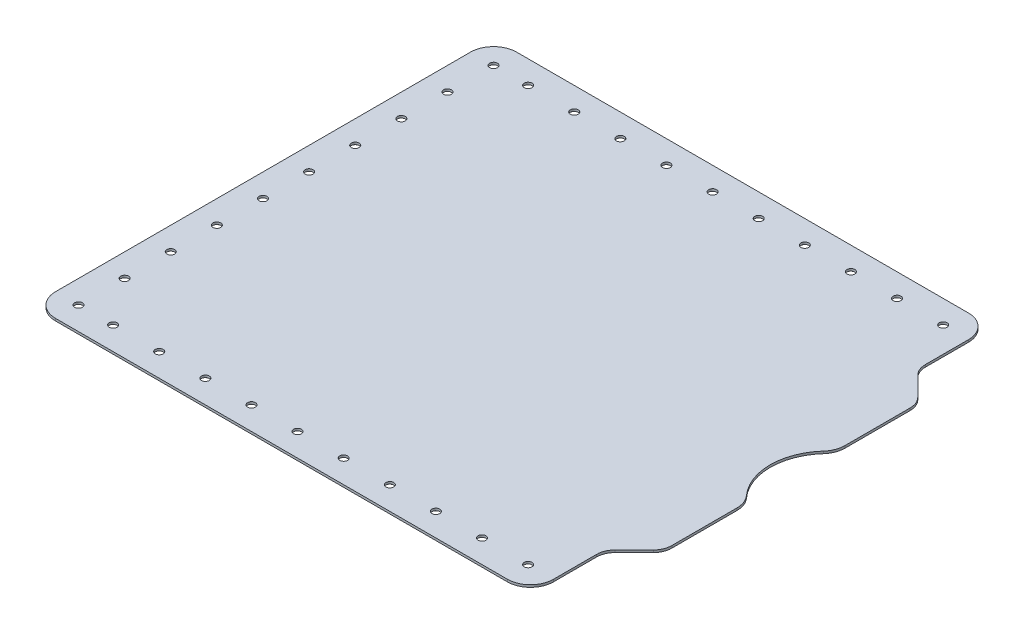
from build123d import *

# Parameters (mm, degrees)
SKETCH1_W                      = 229
SKETCH1_H                      = 200
BOSS_EXTRUDE1_DEPTH            = 1
CUT_EXTRUDE1_DEPTH             = 153.023846814
FILLET1_R                      = 8
FILLET2_R                      = 10
M3_CLEARANCE_HOLE1_AT_2_COUNT  = 2
M3_CLEARANCE_HOLE1_AT_2_PITCH  = 20
M3_CLEARANCE_HOLE1_AT_3_COUNT  = 2
M3_CLEARANCE_HOLE1_AT_3_PITCH  = 40
M3_CLEARANCE_HOLE1_AT_4_COUNT  = 2
M3_CLEARANCE_HOLE1_AT_4_PITCH  = 60
M3_CLEARANCE_HOLE1_AT_5_COUNT  = 2
M3_CLEARANCE_HOLE1_AT_5_PITCH  = 80
M3_CLEARANCE_HOLE1_AT_6_COUNT  = 2
M3_CLEARANCE_HOLE1_AT_6_PITCH  = 100
M3_CLEARANCE_HOLE1_AT_7_COUNT  = 2
M3_CLEARANCE_HOLE1_AT_7_PITCH  = 120
M3_CLEARANCE_HOLE1_AT_8_COUNT  = 2
M3_CLEARANCE_HOLE1_AT_8_PITCH  = 140
M3_CLEARANCE_HOLE1_AT_9_COUNT  = 2
M3_CLEARANCE_HOLE1_AT_9_PITCH  = 160
M3_CLEARANCE_HOLE1_AT_10_COUNT = 2
M3_CLEARANCE_HOLE1_AT_10_PITCH = 180
M3_CLEARANCE_HOLE2_AT_2_COUNT  = 2
M3_CLEARANCE_HOLE2_AT_2_PITCH  = 20
M3_CLEARANCE_HOLE2_AT_3_COUNT  = 2
M3_CLEARANCE_HOLE2_AT_3_PITCH  = 40
M3_CLEARANCE_HOLE2_AT_4_COUNT  = 2
M3_CLEARANCE_HOLE2_AT_4_PITCH  = 60
M3_CLEARANCE_HOLE2_AT_5_COUNT  = 2
M3_CLEARANCE_HOLE2_AT_5_PITCH  = 80
M3_CLEARANCE_HOLE2_AT_6_COUNT  = 2
M3_CLEARANCE_HOLE2_AT_6_PITCH  = 100
M3_CLEARANCE_HOLE2_AT_7_COUNT  = 2
M3_CLEARANCE_HOLE2_AT_7_PITCH  = 120
M3_CLEARANCE_HOLE2_AT_8_COUNT  = 2
M3_CLEARANCE_HOLE2_AT_8_PITCH  = 140
M3_CLEARANCE_HOLE2_AT_9_COUNT  = 2
M3_CLEARANCE_HOLE2_AT_9_PITCH  = 160
M3_CLEARANCE_HOLE2_AT_10_COUNT = 2
M3_CLEARANCE_HOLE2_AT_10_PITCH = 180
M3_CLEARANCE_HOLE2_AT_11_COUNT = 2
M3_CLEARANCE_HOLE2_AT_11_PITCH = 254.558441227
M3_CLEARANCE_HOLE2_AT_12_COUNT = 2
M3_CLEARANCE_HOLE2_AT_12_PITCH = 240.831891576
M3_CLEARANCE_HOLE2_AT_13_COUNT = 2
M3_CLEARANCE_HOLE2_AT_13_PITCH = 228.03508502
M3_CLEARANCE_HOLE2_AT_14_COUNT = 2
M3_CLEARANCE_HOLE2_AT_14_PITCH = 216.333076528
M3_CLEARANCE_HOLE2_AT_15_COUNT = 2
M3_CLEARANCE_HOLE2_AT_15_PITCH = 205.91260282
M3_CLEARANCE_HOLE2_AT_16_COUNT = 2
M3_CLEARANCE_HOLE2_AT_16_PITCH = 196.977156036
M3_CLEARANCE_HOLE2_AT_17_COUNT = 2
M3_CLEARANCE_HOLE2_AT_17_PITCH = 189.73665961
M3_CLEARANCE_HOLE2_AT_18_COUNT = 2
M3_CLEARANCE_HOLE2_AT_18_PITCH = 184.390889146
M3_CLEARANCE_HOLE2_AT_19_COUNT = 2
M3_CLEARANCE_HOLE2_AT_19_PITCH = 181.107702763
M3_CLEARANCE_HOLE2_AT_20_COUNT = 2
M3_CLEARANCE_HOLE2_AT_20_PITCH = 180
SKETCH7_R                      = 25
CUT_EXTRUDE2_DEPTH             = 10
FILLET3_R                      = 10


with BuildPart() as part:
    # Sketch1 → Boss-Extrude1 (new body)
    with BuildSketch(Plane(origin=(0, 0, 0), x_dir=(1, 0, 0), z_dir=(0, 1, 0))):
        Rectangle(SKETCH1_W, SKETCH1_H)
    extrude(amount=BOSS_EXTRUDE1_DEPTH)

    # Sketch2 → Cut-Extrude1 (cut, through all)
    with BuildSketch(Plane(origin=(0, 1, 0), x_dir=(1, 0, 0), z_dir=(0, 1, 0))):
        Polygon((114.5, 55), (101.5, 68), (101.5, 100), (114.5, 100), align=None)
        Polygon((101.5, -100), (114.5, -100), (114.5, -55), (101.5, -68), align=None)
    extrude(amount=-CUT_EXTRUDE1_DEPTH, mode=Mode.SUBTRACT)

    # Fillet1
    fillet1_edges = [part.edges().sort_by_distance(p)[0] for p in [
        (101.5, 0.5, 68),
        (114.5, 0.5, 55),
        (114.5, 0.5, -55),
        (101.5, 0.5, -68),
    ]]
    fillet(fillet1_edges, radius=FILLET1_R)

    # Fillet2
    fillet2_edges = [part.edges().sort_by_distance(p)[0] for p in [
        (-114.5, 0.5, -100),
        (-114.5, 0.5, 100),
        (101.5, 0.5, 100),
        (101.5, 0.5, -100),
    ]]
    fillet(fillet2_edges, radius=FILLET2_R)

    # Sketch4 → M3 Clearance Hole1 (revolve, cut)
    with BuildSketch(Plane(origin=(-104.5, 0, -90), x_dir=(0, 0, -1), z_dir=(1, 0, 0))):
        Polygon((0, 0), (0, 1), (1.7, 1), (1.7, 0.025), (1.725, 0), align=None)
    m3_clearance_hole1 = revolve(axis=Axis((-104.5, -6.35, -90), (0, 1, 0)), mode=Mode.SUBTRACT)

    # M3 Clearance Hole1 at 2: M3 Clearance Hole1 ×2
    with Locations(*[(0, 0, i * M3_CLEARANCE_HOLE1_AT_2_PITCH) for i in range(1, M3_CLEARANCE_HOLE1_AT_2_COUNT)]):
        add(m3_clearance_hole1, mode=Mode.SUBTRACT)

    # M3 Clearance Hole1 at 3: M3 Clearance Hole1 ×2
    with Locations(*[(0, 0, i * M3_CLEARANCE_HOLE1_AT_3_PITCH) for i in range(1, M3_CLEARANCE_HOLE1_AT_3_COUNT)]):
        add(m3_clearance_hole1, mode=Mode.SUBTRACT)

    # M3 Clearance Hole1 at 4: M3 Clearance Hole1 ×2
    with Locations(*[(0, 0, i * M3_CLEARANCE_HOLE1_AT_4_PITCH) for i in range(1, M3_CLEARANCE_HOLE1_AT_4_COUNT)]):
        add(m3_clearance_hole1, mode=Mode.SUBTRACT)

    # M3 Clearance Hole1 at 5: M3 Clearance Hole1 ×2
    with Locations(*[(0, 0, i * M3_CLEARANCE_HOLE1_AT_5_PITCH) for i in range(1, M3_CLEARANCE_HOLE1_AT_5_COUNT)]):
        add(m3_clearance_hole1, mode=Mode.SUBTRACT)

    # M3 Clearance Hole1 at 6: M3 Clearance Hole1 ×2
    with Locations(*[(0, 0, i * M3_CLEARANCE_HOLE1_AT_6_PITCH) for i in range(1, M3_CLEARANCE_HOLE1_AT_6_COUNT)]):
        add(m3_clearance_hole1, mode=Mode.SUBTRACT)

    # M3 Clearance Hole1 at 7: M3 Clearance Hole1 ×2
    with Locations(*[(0, 0, i * M3_CLEARANCE_HOLE1_AT_7_PITCH) for i in range(1, M3_CLEARANCE_HOLE1_AT_7_COUNT)]):
        add(m3_clearance_hole1, mode=Mode.SUBTRACT)

    # M3 Clearance Hole1 at 8: M3 Clearance Hole1 ×2
    with Locations(*[(0, 0, i * M3_CLEARANCE_HOLE1_AT_8_PITCH) for i in range(1, M3_CLEARANCE_HOLE1_AT_8_COUNT)]):
        add(m3_clearance_hole1, mode=Mode.SUBTRACT)

    # M3 Clearance Hole1 at 9: M3 Clearance Hole1 ×2
    with Locations(*[(0, 0, i * M3_CLEARANCE_HOLE1_AT_9_PITCH) for i in range(1, M3_CLEARANCE_HOLE1_AT_9_COUNT)]):
        add(m3_clearance_hole1, mode=Mode.SUBTRACT)

    # M3 Clearance Hole1 at 10: M3 Clearance Hole1 ×2
    with Locations(*[(0, 0, i * M3_CLEARANCE_HOLE1_AT_10_PITCH) for i in range(1, M3_CLEARANCE_HOLE1_AT_10_COUNT)]):
        add(m3_clearance_hole1, mode=Mode.SUBTRACT)

    # Sketch6 → M3 Clearance Hole2 (revolve, cut)
    with BuildSketch(Plane(origin=(90.5, 0, -90), x_dir=(0, 0, -1), z_dir=(1, 0, 0))):
        Polygon((0, 0), (0, 1), (1.7, 1), (1.7, 0.025), (1.725, 0), align=None)
    m3_clearance_hole2 = revolve(axis=Axis((90.5, -6.35, -90), (0, 1, 0)), mode=Mode.SUBTRACT)

    # M3 Clearance Hole2 at 2: M3 Clearance Hole2 ×2
    with Locations(*[(-i * M3_CLEARANCE_HOLE2_AT_2_PITCH, 0, 0) for i in range(1, M3_CLEARANCE_HOLE2_AT_2_COUNT)]):
        add(m3_clearance_hole2, mode=Mode.SUBTRACT)

    # M3 Clearance Hole2 at 3: M3 Clearance Hole2 ×2
    with Locations(*[(-i * M3_CLEARANCE_HOLE2_AT_3_PITCH, 0, 0) for i in range(1, M3_CLEARANCE_HOLE2_AT_3_COUNT)]):
        add(m3_clearance_hole2, mode=Mode.SUBTRACT)

    # M3 Clearance Hole2 at 4: M3 Clearance Hole2 ×2
    with Locations(*[(-i * M3_CLEARANCE_HOLE2_AT_4_PITCH, 0, 0) for i in range(1, M3_CLEARANCE_HOLE2_AT_4_COUNT)]):
        add(m3_clearance_hole2, mode=Mode.SUBTRACT)

    # M3 Clearance Hole2 at 5: M3 Clearance Hole2 ×2
    with Locations(*[(-i * M3_CLEARANCE_HOLE2_AT_5_PITCH, 0, 0) for i in range(1, M3_CLEARANCE_HOLE2_AT_5_COUNT)]):
        add(m3_clearance_hole2, mode=Mode.SUBTRACT)

    # M3 Clearance Hole2 at 6: M3 Clearance Hole2 ×2
    with Locations(*[(-i * M3_CLEARANCE_HOLE2_AT_6_PITCH, 0, 0) for i in range(1, M3_CLEARANCE_HOLE2_AT_6_COUNT)]):
        add(m3_clearance_hole2, mode=Mode.SUBTRACT)

    # M3 Clearance Hole2 at 7: M3 Clearance Hole2 ×2
    with Locations(*[(-i * M3_CLEARANCE_HOLE2_AT_7_PITCH, 0, 0) for i in range(1, M3_CLEARANCE_HOLE2_AT_7_COUNT)]):
        add(m3_clearance_hole2, mode=Mode.SUBTRACT)

    # M3 Clearance Hole2 at 8: M3 Clearance Hole2 ×2
    with Locations(*[(-i * M3_CLEARANCE_HOLE2_AT_8_PITCH, 0, 0) for i in range(1, M3_CLEARANCE_HOLE2_AT_8_COUNT)]):
        add(m3_clearance_hole2, mode=Mode.SUBTRACT)

    # M3 Clearance Hole2 at 9: M3 Clearance Hole2 ×2
    with Locations(*[(-i * M3_CLEARANCE_HOLE2_AT_9_PITCH, 0, 0) for i in range(1, M3_CLEARANCE_HOLE2_AT_9_COUNT)]):
        add(m3_clearance_hole2, mode=Mode.SUBTRACT)

    # M3 Clearance Hole2 at 10: M3 Clearance Hole2 ×2
    with Locations(*[(-i * M3_CLEARANCE_HOLE2_AT_10_PITCH, 0, 0) for i in range(1, M3_CLEARANCE_HOLE2_AT_10_COUNT)]):
        add(m3_clearance_hole2, mode=Mode.SUBTRACT)

    # M3 Clearance Hole2 at 11: M3 Clearance Hole2 ×2
    with Locations(*[Vector(-0.7071067811865476, 0, 0.7071067811865475) * (i * M3_CLEARANCE_HOLE2_AT_11_PITCH) for i in range(1, M3_CLEARANCE_HOLE2_AT_11_COUNT)]):
        add(m3_clearance_hole2, mode=Mode.SUBTRACT)

    # M3 Clearance Hole2 at 12: M3 Clearance Hole2 ×2
    with Locations(*[Vector(-0.6643638388299199, 0, 0.7474093186836597) * (i * M3_CLEARANCE_HOLE2_AT_12_PITCH) for i in range(1, M3_CLEARANCE_HOLE2_AT_12_COUNT)]):
        add(m3_clearance_hole2, mode=Mode.SUBTRACT)

    # M3 Clearance Hole2 at 13: M3 Clearance Hole2 ×2
    with Locations(*[Vector(-0.6139406135149206, 0, 0.7893522173763263) * (i * M3_CLEARANCE_HOLE2_AT_13_PITCH) for i in range(1, M3_CLEARANCE_HOLE2_AT_13_COUNT)]):
        add(m3_clearance_hole2, mode=Mode.SUBTRACT)

    # M3 Clearance Hole2 at 14: M3 Clearance Hole2 ×2
    with Locations(*[Vector(-0.5547001962252293, 0, 0.8320502943378437) * (i * M3_CLEARANCE_HOLE2_AT_14_PITCH) for i in range(1, M3_CLEARANCE_HOLE2_AT_14_COUNT)]):
        add(m3_clearance_hole2, mode=Mode.SUBTRACT)

    # M3 Clearance Hole2 at 15: M3 Clearance Hole2 ×2
    with Locations(*[Vector(-0.4856429311786322, 0, 0.8741572761215377) * (i * M3_CLEARANCE_HOLE2_AT_15_PITCH) for i in range(1, M3_CLEARANCE_HOLE2_AT_15_COUNT)]):
        add(m3_clearance_hole2, mode=Mode.SUBTRACT)

    # M3 Clearance Hole2 at 16: M3 Clearance Hole2 ×2
    with Locations(*[Vector(-0.40613846605344767, 0, 0.9138115486202572) * (i * M3_CLEARANCE_HOLE2_AT_16_PITCH) for i in range(1, M3_CLEARANCE_HOLE2_AT_16_COUNT)]):
        add(m3_clearance_hole2, mode=Mode.SUBTRACT)

    # M3 Clearance Hole2 at 17: M3 Clearance Hole2 ×2
    with Locations(*[Vector(-0.316227766016838, 0, 0.9486832980505139) * (i * M3_CLEARANCE_HOLE2_AT_17_PITCH) for i in range(1, M3_CLEARANCE_HOLE2_AT_17_COUNT)]):
        add(m3_clearance_hole2, mode=Mode.SUBTRACT)

    # M3 Clearance Hole2 at 18: M3 Clearance Hole2 ×2
    with Locations(*[Vector(-0.21693045781865622, 0, 0.9761870601839527) * (i * M3_CLEARANCE_HOLE2_AT_18_PITCH) for i in range(1, M3_CLEARANCE_HOLE2_AT_18_COUNT)]):
        add(m3_clearance_hole2, mode=Mode.SUBTRACT)

    # M3 Clearance Hole2 at 19: M3 Clearance Hole2 ×2
    with Locations(*[Vector(-0.11043152607484664, 0, 0.9938837346736189) * (i * M3_CLEARANCE_HOLE2_AT_19_PITCH) for i in range(1, M3_CLEARANCE_HOLE2_AT_19_COUNT)]):
        add(m3_clearance_hole2, mode=Mode.SUBTRACT)

    # M3 Clearance Hole2 at 20: M3 Clearance Hole2 ×2
    with Locations(*[(0, 0, i * M3_CLEARANCE_HOLE2_AT_20_PITCH) for i in range(1, M3_CLEARANCE_HOLE2_AT_20_COUNT)]):
        add(m3_clearance_hole2, mode=Mode.SUBTRACT)

    # Sketch7 → Cut-Extrude2 (cut)
    with BuildSketch(Plane(origin=(0, 0, 0), x_dir=(-1, 0, 0), z_dir=(0, -1, 0))):
        with Locations((-130.5, 0)):
            Circle(SKETCH7_R)
    extrude(amount=-CUT_EXTRUDE2_DEPTH, mode=Mode.SUBTRACT)

    # Fillet3
    fillet3_edges = [part.edges().sort_by_distance(p)[0] for p in [
        (114.5, 0.5, 19.209372712),
        (114.5, 0.5, -19.209372712),
    ]]
    fillet(fillet3_edges, radius=FILLET3_R)


solid = part.part
